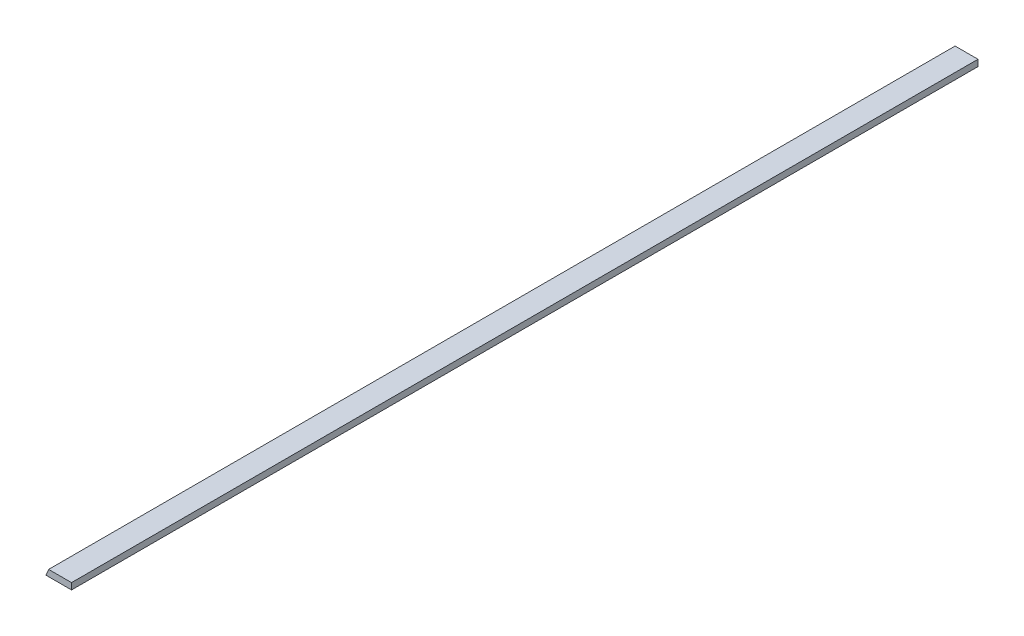
from build123d import *

# Parameters (mm, degrees)
BOSS_EXTRUDE1_DEPTH = 901.7


with BuildPart() as part:
    # Sketch1 → Boss-Extrude1 (new body)
    with BuildSketch(Plane.XY):
        Polygon((0, 0), (25.4, 0), (25.4, 6.35), (2.630256121, 6.35), align=None)
    extrude(amount=BOSS_EXTRUDE1_DEPTH)


solid = part.part
